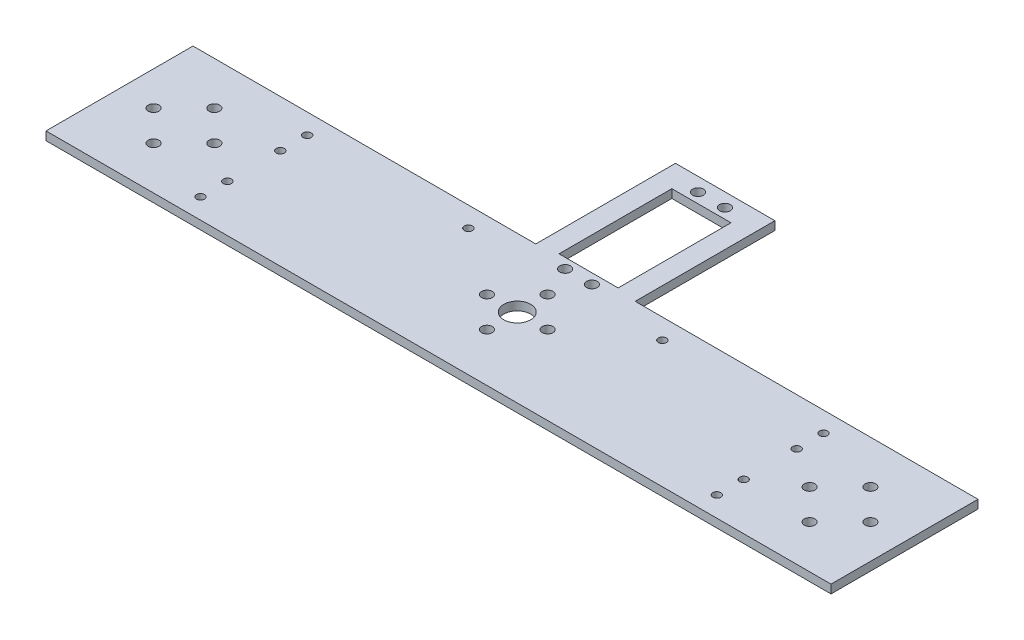
from build123d import *

# Parameters (mm, degrees)
SKETCH1_R           = 5
SKETCH1_R_2         = 2
BOSS_EXTRUDE1_DEPTH = 3.175
SKETCH2_R           = 1.5
CUT_EXTRUDE1_DEPTH  = 10
SKETCH3_R           = 2
CUT_EXTRUDE2_DEPTH  = 10


with BuildPart() as part:
    # Sketch1 → Boss-Extrude1 (new body)
    with BuildSketch(Plane(origin=(0, 0, 0), x_dir=(1, 0, 0), z_dir=(0, 1, 0))):
        Polygon((292.2, 0), (164.6, 0), (164.6, 52), (127.6, 52), (127.6, 0), (0, 0), (0, -54.713708499), (292.2, -54.713708499), align=None)
        with Locations((146.1, -25.4)):
            Circle(SKETCH1_R, mode=Mode.SUBTRACT)
        with Locations((146.1, -14.086291501)):
            Circle(SKETCH1_R_2, mode=Mode.SUBTRACT)
        with Locations((157.413708499, -25.4)):
            Circle(SKETCH1_R_2, mode=Mode.SUBTRACT)
        with Locations((134.786291501, -25.4)):
            Circle(SKETCH1_R_2, mode=Mode.SUBTRACT)
        with Locations((151.1, -2.6025933)):
            Circle(SKETCH1_R_2, mode=Mode.SUBTRACT)
        with Locations((146.1, -36.713708499)):
            Circle(SKETCH1_R_2, mode=Mode.SUBTRACT)
        with Locations((141.1, -2.6025933)):
            Circle(SKETCH1_R_2, mode=Mode.SUBTRACT)
        with Locations((141.1, 46.8974067)):
            Circle(SKETCH1_R_2, mode=Mode.SUBTRACT)
        Polygon((157.1, 1.1474067), (146.1, 1.1474067), (135.1, 1.1474067), (135.1, 43.1474067), (146.1, 43.1474067), (157.1, 43.1474067), align=None, mode=Mode.SUBTRACT)
        with Locations((151.1, 46.8974067)):
            Circle(SKETCH1_R_2, mode=Mode.SUBTRACT)
    extrude(amount=BOSS_EXTRUDE1_DEPTH)

    # Sketch2 → Cut-Extrude1 (cut)
    with BuildSketch(Plane.XZ):
        with Locations((50, 47.213708499)):
            Circle(SKETCH2_R)
        with Locations((50, 7.5)):
            Circle(SKETCH2_R)
        with Locations((110, 7.5)):
            Circle(SKETCH2_R)
        with Locations((182.2, 7.5)):
            Circle(SKETCH2_R)
        with Locations((242.2, 7.5)):
            Circle(SKETCH2_R)
        with Locations((242.2, 47.213708499)):
            Circle(SKETCH2_R)
        with Locations((50, 37.213708499)):
            Circle(SKETCH2_R)
        with Locations((50, 17.5)):
            Circle(SKETCH2_R)
        with Locations((242.2, 37.213708499)):
            Circle(SKETCH2_R)
        with Locations((242.2, 17.5)):
            Circle(SKETCH2_R)
    extrude(amount=-CUT_EXTRUDE1_DEPTH, mode=Mode.SUBTRACT)

    # Sketch3 → Cut-Extrude2 (cut)
    with BuildSketch(Plane.XZ):
        with Locations((24, 38.670562748)):
            Circle(SKETCH3_R)
        with Locations((12.686291501, 27.356854249)):
            Circle(SKETCH3_R)
        with Locations((35.313708499, 27.356854249)):
            Circle(SKETCH3_R)
        with Locations((24, 16.043145751)):
            Circle(SKETCH3_R)
        with Locations((268.2, 16.043145751)):
            Circle(SKETCH3_R)
        with Locations((279.513708499, 27.356854249)):
            Circle(SKETCH3_R)
        with Locations((268.2, 38.670562748)):
            Circle(SKETCH3_R)
        with Locations((256.886291501, 27.356854249)):
            Circle(SKETCH3_R)
    extrude(amount=-CUT_EXTRUDE2_DEPTH, mode=Mode.SUBTRACT)


solid = part.part
